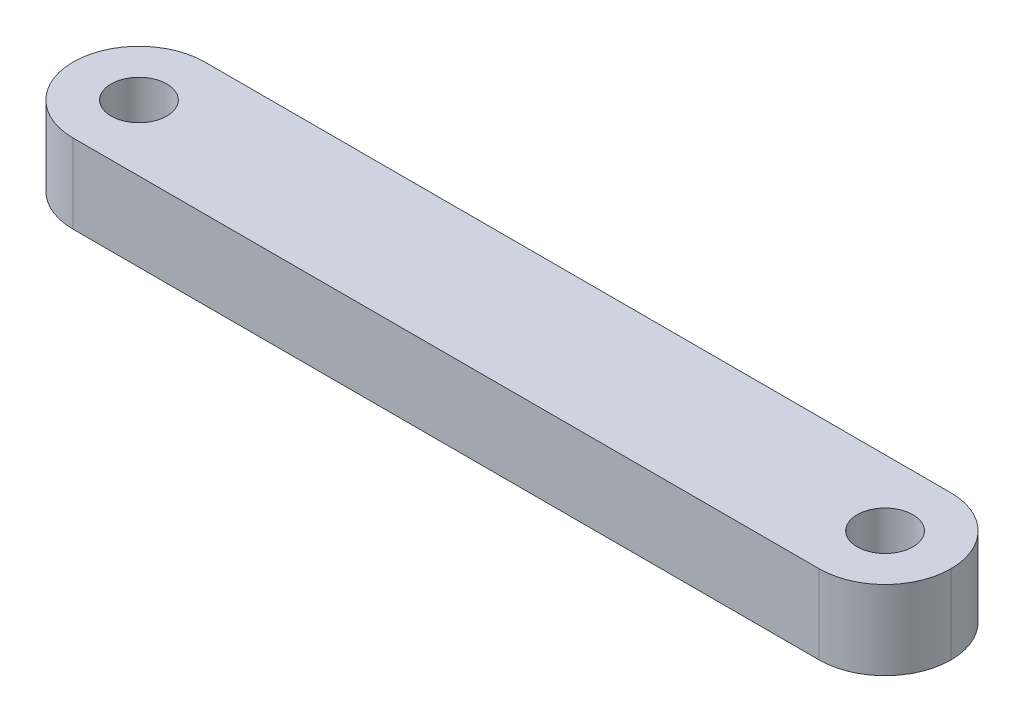
from build123d import *

# Parameters (mm, degrees)
BOSS_EXTRUDE1_DEPTH = 9
FILLET1_R           = 7.5


with BuildPart() as part:
    # Sketch1 → Boss-Extrude1 (new body)
    with BuildSketch(Plane(origin=(0, 0, 0), x_dir=(1, 0, 0), z_dir=(0, 1, 0))):
        with BuildLine():
            Line((-50, 7.5), (-50, -7.5))
            Line((-50, -7.5), (-42.5, -7.5))
            Line((-42.5, -7.5), (-42.5, -3.175))
            ThreePointArc((-42.5, -3.175), (-45.675, 0), (-42.5, 3.175))
            Line((-42.5, 3.175), (-42.5, 7.5))
            Line((-42.5, 7.5), (-50, 7.5))
        make_face()
        with BuildLine():
            Line((-42.5, -3.175), (-42.5, -7.5))
            Line((-42.5, -7.5), (42.5, -7.5))
            Line((42.5, -7.5), (42.5, -3.175))
            ThreePointArc((42.5, -3.175), (39.325, 0), (42.5, 3.175))
            Line((42.5, 3.175), (42.5, 7.5))
            Line((42.5, 7.5), (-42.5, 7.5))
            Line((-42.5, 7.5), (-42.5, 3.175))
            ThreePointArc((-42.5, 3.175), (-40.25493597, 2.24506403), (-39.325, 0))
            ThreePointArc((-39.325, 0), (-40.25493597, -2.24506403), (-42.5, -3.175))
        make_face()
        with BuildLine():
            Line((42.5, -3.175), (42.5, -7.5))
            Line((42.5, -7.5), (50, -7.5))
            Line((50, -7.5), (50, 7.5))
            Line((50, 7.5), (42.5, 7.5))
            Line((42.5, 7.5), (42.5, 3.175))
            ThreePointArc((42.5, 3.175), (44.74506403, 2.24506403), (45.675, 0))
            ThreePointArc((45.675, 0), (44.74506403, -2.24506403), (42.5, -3.175))
        make_face()
    extrude(amount=BOSS_EXTRUDE1_DEPTH)

    # Fillet1
    fillet1_edges = [part.edges().sort_by_distance(p)[0] for p in [
        (50, 4.5, 7.5),
        (50, 4.5, -7.5),
        (-50, 4.5, 7.5),
        (-50, 4.5, -7.5),
    ]]
    fillet(fillet1_edges, radius=FILLET1_R - 0.0001)  # a hair under: the kernel refuses the full size


solid = part.part
